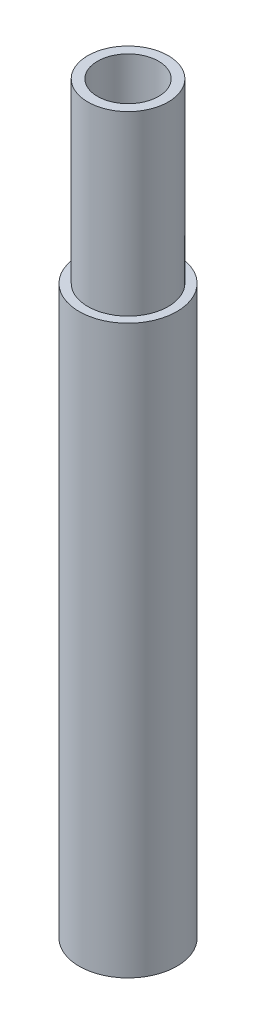
from build123d import *

# Parameters (mm, degrees)
THREAD1_PITCH = 0.705555556


with BuildPart() as part:
    # Sketch1 → Revolve1 (revolve)
    with BuildSketch(Plane.XY, mode=Mode.PRIVATE) as revolve1_sk:
        Polygon((-5.055, 0), (-5.055, 58.67), (-4.16, 58.67), (-4.16, 77), (-3.16, 77), (-3.16, 57.67), (-4.055, 57.67), (-4.055, 0), align=None)
    revolve(revolve1_sk.sketch.rotate(Axis((0, 0, 0), (0, 1, 0)), 270), axis=Axis((0, 0, 0), (0, 1, 0)))

    # Thread1: the profile of Thread Profile1 profile screwed along a right-hand helix of 19.091339 turns, 6 arcs to a turn; built about Z, then put on its axis
    thread1_z = Axis((0, 0, 0), (0, 0, 1))
    thread1_corners = [(4.0553, 0, -0.000173205), (4.0553, 0, 0.617534314), (3.673106855, 0, 0.396874999), (3.673106855, 0, 0.22048611)]
    with BuildLine(mode=Mode.PRIVATE) as thread1_profile:
        Line(thread1_corners[0], thread1_corners[1])
        Line(thread1_corners[1], thread1_corners[2])
        Line(thread1_corners[2], thread1_corners[3])
        Line(thread1_corners[3], thread1_corners[0])
    thread1_cap = Face(thread1_profile.wire())
    thread1_turn_angles = [0, 30, 60, 90, 120, 150, 180, 210, 240, 270, 300, 330, 360]
    thread1_turn_weights = [1, 0.8660254037844387, 1, 0.8660254037844387, 1, 0.8660254037844387, 1, 0.8660254037844387, 1, 0.8660254037844387, 1, 0.8660254037844387, 1]
    thread1_turn_rails = [Edge.make_bspline([Vector(p[0], p[1], 0).rotate(thread1_z, thread1_turn_angles[k]) / thread1_turn_weights[k] + Vector(0, 0, p[2] + THREAD1_PITCH * thread1_turn_angles[k] / 360) for k in range(13)], [0, 0, 0, 1, 1, 2, 2, 3, 3, 4, 4, 5, 5, 6, 6, 6], 2, thread1_turn_weights) for p in thread1_corners]
    thread1_turn_sides = [Face.make_surface_from_curves(thread1_turn_rails[p[0]], thread1_turn_rails[p[1]]) for p in [(0, 1), (1, 2), (2, 3), (3, 0)]]
    thread1_last_angles = [6840, 6856.440944882, 6872.881889764]
    thread1_last_weights = [1, 0.9591119619039714, 1]
    thread1_last_rails = [Edge.make_bspline([Vector(p[0], p[1], 0).rotate(thread1_z, thread1_last_angles[k]) / thread1_last_weights[k] + Vector(0, 0, p[2] + THREAD1_PITCH * thread1_last_angles[k] / 360) for k in range(3)], [0, 0, 0, 1, 1, 1], 2, thread1_last_weights) for p in thread1_corners]
    thread1_last_sides = [Face.make_surface_from_curves(thread1_last_rails[p[0]], thread1_last_rails[p[1]]) for p in [(0, 1), (1, 2), (2, 3), (3, 0)]]
    thread1 = Plane(origin=(0, 0, 0), x_dir=(1, 0, 0), z_dir=(0, 1, 0)) * Solid(Shell([*[p.moved(Location((0, 0, THREAD1_PITCH * i))) for i in range(19) for p in thread1_turn_sides], *thread1_last_sides, thread1_cap, thread1_cap.rotate(thread1_z, 6872.881889764).moved(Location((0, 0, THREAD1_PITCH * 6872.881889764 / 360)))]))
    add(thread1)


solid = part.part
